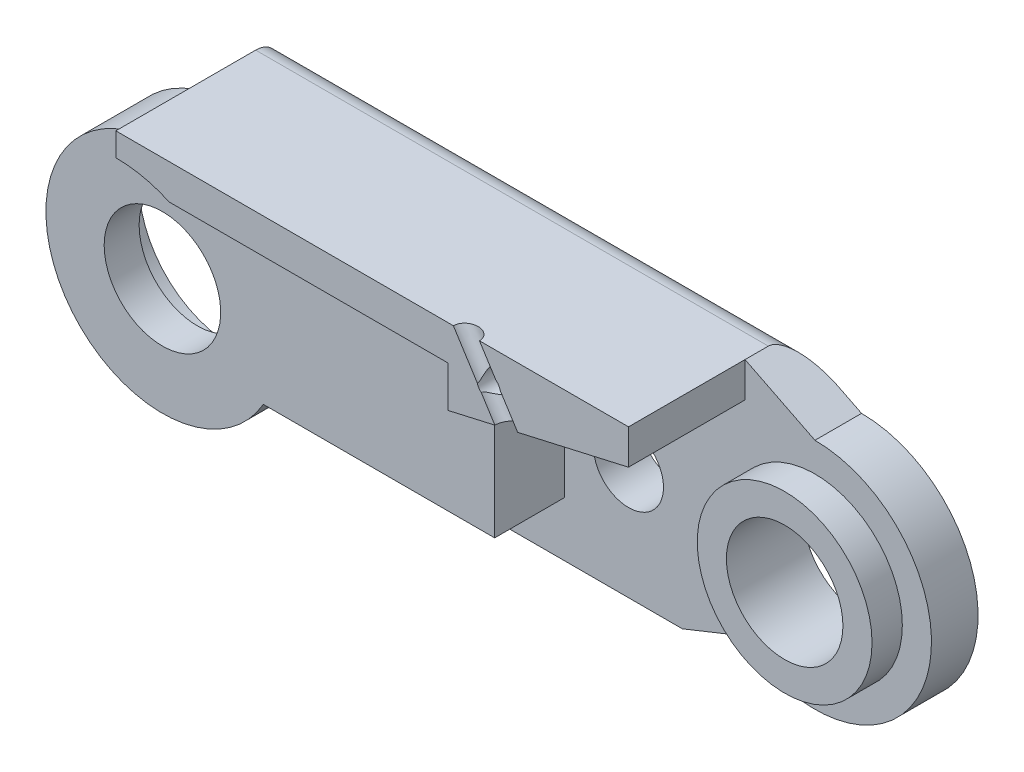
from build123d import *

# Parameters (mm, degrees)
BOSS_EXTRUDE1_DEPTH = 2
BOSS_EXTRUDE2_DEPTH = 5
BOSS_EXTRUDE3_DEPTH = 3
SKETCH7_R           = 2.5
CUT_EXTRUDE1_DEPTH  = 3
SKETCH8_R           = 4
CUT_EXTRUDE2_DEPTH  = 1.5
SKETCH12_R          = 3.75
BOSS_EXTRUDE5_DEPTH = 1.3
SKETCH13_R          = 2.5
CUT_EXTRUDE4_DEPTH  = 32.484122983
FILLET2_R           = 1
SKETCH14_R          = 1.5
CUT_EXTRUDE5_DEPTH  = 10
BOSS_EXTRUDE6_DEPTH = 5
SKETCH17_R          = 0.5
CUT_EXTRUDE6_DEPTH  = 32.484122983
SKETCH19_R          = 0.501737203
CUT_EXTRUDE7_DEPTH  = 5


with BuildPart() as part:
    # Sketch3 → Boss-Extrude1 (new body)
    with BuildSketch(Plane.XY):
        with BuildLine():
            Line((0, 5.5), (0, 6.5))
            Line((0, 6.5), (22, 6.5))
            Line((22, 6.5), (25, 5))
            ThreePointArc((25, 5), (29.704067696, -1.694623001), (21.811351474, -3.851301154))
            Line((21.811351474, -3.851301154), (19.311351474, -4.851301154))
            Line((19.311351474, -4.851301154), (6.5, -4.851301154))
            Line((6.5, -4.851301154), (6.5, -2.5))
            Line((6.5, -2.5), (5.5, 0))
            ThreePointArc((5.5, 0), (3.889087297, 3.889087297), (0, 5.5))
        make_face()
    extrude(amount=BOSS_EXTRUDE1_DEPTH)

    # Sketch4 → Boss-Extrude2 (add)
    with BuildSketch(Plane.XY.offset(2)):
        with BuildLine():
            Line((0, 6.5), (22, 6.5))
            Line((22, 6.5), (22, 5))
            Line((22, 5), (2.291287847, 5))
            ThreePointArc((2.291287847, 5), (1.17260394, 5.373546315), (0, 5.5))
            Line((0, 5.5), (0, 6.5))
        make_face()
    extrude(amount=BOSS_EXTRUDE2_DEPTH)

    # Sketch6 → Boss-Extrude3 (add)
    with BuildSketch(Plane.XY.offset(2)):
        with BuildLine():
            Line((2.291287847, 5), (12.145643924, 5))
            Line((12.145643924, 5), (14.255887023, 5))
            Line((14.255887023, 5), (14.255887023, -2.5))
            Line((14.255887023, -2.5), (12.145643924, -2.5))
            Line((12.145643924, -2.5), (6.5, -2.5))
            Line((6.5, -2.5), (4.330127019, -2.5))
            ThreePointArc((4.330127019, -2.5), (-4.330127019, -2.5), (0, 5))
            Line((0, 5), (0, 5.5))
            ThreePointArc((0, 5.5), (1.17260394, 5.373546315), (2.291287847, 5))
        make_face()
    extrude(amount=BOSS_EXTRUDE3_DEPTH)

    # Sketch7 → Cut-Extrude1 (cut)
    with BuildSketch(Plane(origin=(0, 0, 2), x_dir=(-1, 0, 0), z_dir=(0, 0, -1))):
        Circle(SKETCH7_R)
    extrude(amount=-CUT_EXTRUDE1_DEPTH, mode=Mode.SUBTRACT)

    # Sketch8 → Cut-Extrude2 (cut)
    with BuildSketch(Plane(origin=(0, 0, 2), x_dir=(-1, 0, 0), z_dir=(0, 0, -1))):
        Circle(SKETCH8_R)
    extrude(amount=-CUT_EXTRUDE2_DEPTH, mode=Mode.SUBTRACT)

    # Sketch12 → Boss-Extrude5 (add)
    with BuildSketch(Plane.XY.offset(2)):
        with Locations((25, 0)):
            Circle(SKETCH12_R)
    extrude(amount=BOSS_EXTRUDE5_DEPTH)

    # Sketch13 → Cut-Extrude4 (cut, through all)
    with BuildSketch(Plane(origin=(0, 0, 0), x_dir=(-1, 0, 0), z_dir=(0, 0, -1))):
        with Locations((-25, 0)):
            Circle(SKETCH13_R)
    extrude(amount=-CUT_EXTRUDE4_DEPTH, mode=Mode.SUBTRACT)

    # Fillet2
    fillet2_edges = [part.edges().sort_by_distance(p)[0] for p in [
        (12.905675737, -4.851301154, 0),
        (11, 6.5, 0),
    ]]
    fillet(fillet2_edges, radius=FILLET2_R - 0.0001)  # a hair under: the kernel refuses the full size

    # Sketch14 → Cut-Extrude5 (cut)
    with BuildSketch(Plane(origin=(0, 0, 0), x_dir=(-1, 0, 0), z_dir=(0, 0, -1))):
        with Locations((-17, 0)):
            Circle(SKETCH14_R)
    extrude(amount=-CUT_EXTRUDE5_DEPTH, mode=Mode.SUBTRACT)

    # Sketch16 → Boss-Extrude6 (add)
    with BuildSketch(Plane.XY.offset(2)):
        Polygon((14.255887023, 5), (14.255887023, 3.237297895), (22, 5), align=None)
    extrude(amount=BOSS_EXTRUDE6_DEPTH)

    # Sketch17 → Cut-Extrude6 (cut, through all)
    with BuildSketch(Plane.XY.offset(7)):
        with Locations((16, 5)):
            Circle(SKETCH17_R)
    extrude(amount=-CUT_EXTRUDE6_DEPTH, mode=Mode.SUBTRACT)

    # Sketch19 → Cut-Extrude7 (cut, along a direction that is not the sketch's normal)
    with BuildSketch(Plane(origin=(0.001645419, -0.007228852, 0), x_dir=(0.9750599765095712, 0.2219415288069236, 0), z_dir=(0.2219415288069236, -0.9750599765095712, 0))):
        with Locations((17.181227497, 7)):
            Circle(SKETCH19_R)
    extrude(amount=-CUT_EXTRUDE7_DEPTH, dir=(0.5357888185412162, -0.8443520248842943, 0), mode=Mode.SUBTRACT)


solid = part.part
